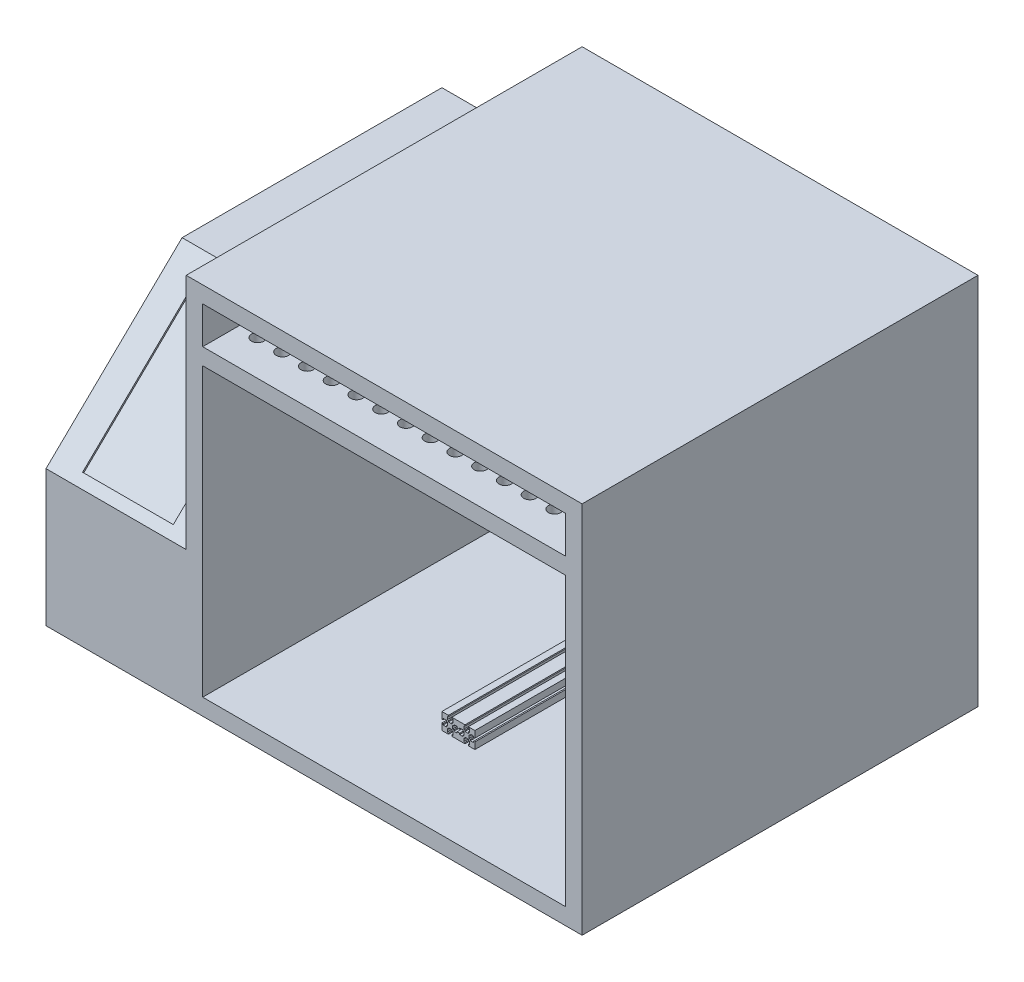
from build123d import *

# Parameters (mm, degrees)
SKETCH_1_W           = 150
SKETCH_1_H           = 285
SKETCH_1_W_2         = 440
SKETCH_1_H_2         = 348
SKETCH_1_H_3         = 45
EXTRUDE_1_DEPTH      = 480
EXTRUDE_2_DEPTH      = 20
SKETCH_3_R           = 7.5
CUT_EXTRUDE_7_DEPTH  = 20
SKETCH_3_8_R         = 7.5
CUT_EXTRUDE_8_DEPTH  = 20
SKETCH_3_9_R         = 7.5
CUT_EXTRUDE_9_DEPTH  = 20
SKETCH_3_10_R        = 7.5
CUT_EXTRUDE_10_DEPTH = 20
SKETCH_3_11_R        = 7.5
CUT_EXTRUDE_11_DEPTH = 20
SKETCH_10_W          = 40
SKETCH_10_H          = 350
EXTRUDE_4_DEPTH      = 20
SKETCH_11_W          = 40
SKETCH_11_H          = 20
EXTRUDE_6_DEPTH      = 348
CUT_EXTRUDE_12_DEPTH = 170
SKETCH_13_W          = 190
SKETCH_13_H          = 165
EXTRUDE_7_DEPTH      = 20
SKETCH_14_W          = 170
SKETCH_14_H          = 229.728125904
EXTRUDE_8_DEPTH      = 15
SKETCH_15_W          = 110
SKETCH_15_H          = 196.836898691
CUT_EXTRUDE_13_DEPTH = 2
EXTRUDE_12_DEPTH     = 20
SKETCH_17_W          = 43
SKETCH_17_H          = 43
EXTRUDE_13_DEPTH     = 20
SKETCH_18_W          = 40
SKETCH_18_H          = 41.625543016
EXTRUDE_14_DEPTH     = 40
SKETCH_19_W          = 40
SKETCH_19_H          = 40
EXTRUDE_15_DEPTH     = 40
EXTRUDE_16_DEPTH     = 2
SKETCH_22_R          = 4
EXTRUDE_17_DEPTH     = 308
SKETCH_23_R          = 12.5
EXTRUDE_18_DEPTH     = 18.496919089
CUT_EXTRUDE_14_DEPTH = 350
CUT_EXTRUDE_16_DEPTH = 395
EXTRUDE_19_DEPTH     = 10
SKETCH_28_R          = 2.5
CUT_EXTRUDE_17_DEPTH = 348


with BuildPart() as part:
    # 草图1 → 凸台-拉伸1 (new body)
    with BuildSketch(Plane.XY):
        Polygon((0, 325), (0, 0), (650, 0), (650, 453), (170, 453), (170, 325), align=None)
        with Locations((95, 162.5)):
            Rectangle(SKETCH_1_W, SKETCH_1_H, mode=Mode.SUBTRACT)
        with Locations((410, 194)):
            Rectangle(SKETCH_1_W_2, SKETCH_1_H_2, mode=Mode.SUBTRACT)
        with Locations((410, 410.5)):
            Rectangle(SKETCH_1_W_2, SKETCH_1_H_3, mode=Mode.SUBTRACT)
    extrude(amount=EXTRUDE_1_DEPTH)

    # 草图2 → 凸台-拉伸2 (add)
    with BuildSketch(Plane(origin=(0, 0, 0), x_dir=(-1, 0, 0), z_dir=(0, 0, -1))):
        Polygon((-650, 453), (-170, 453), (-170, 325), (0, 325), (0, 0), (-170, 0), (-650, 0), align=None)
    extrude(amount=-EXTRUDE_2_DEPTH)

    # 草图3 → 切除-拉伸7 (cut)
    with BuildSketch(Plane.XZ.offset(-368)):
        with Locations((213.812, 437.12)):
            Circle(SKETCH_3_R)
        with Locations((213.812, 407.12)):
            Circle(SKETCH_3_R)
        with Locations((213.812, 377.12)):
            Circle(SKETCH_3_R)
        with Locations((213.812, 347.12)):
            Circle(SKETCH_3_R)
        with Locations((213.812, 317.12)):
            Circle(SKETCH_3_R)
        with Locations((213.812, 287.12)):
            Circle(SKETCH_3_R)
        with Locations((213.812, 257.12)):
            Circle(SKETCH_3_R)
        with Locations((213.812, 227.12)):
            Circle(SKETCH_3_R)
        with Locations((213.812, 197.12)):
            Circle(SKETCH_3_R)
        with Locations((213.812, 167.12)):
            Circle(SKETCH_3_R)
        with Locations((213.812, 137.12)):
            Circle(SKETCH_3_R)
        with Locations((213.812, 107.12)):
            Circle(SKETCH_3_R)
        with Locations((213.812, 77.12)):
            Circle(SKETCH_3_R)
        with Locations((213.812, 47.12)):
            Circle(SKETCH_3_R)
        with Locations((243.812, 407.12)):
            Circle(SKETCH_3_R)
        with Locations((243.812, 377.12)):
            Circle(SKETCH_3_R)
        with Locations((243.812, 347.12)):
            Circle(SKETCH_3_R)
        with Locations((243.812, 317.12)):
            Circle(SKETCH_3_R)
        with Locations((243.812, 287.12)):
            Circle(SKETCH_3_R)
        with Locations((243.812, 257.12)):
            Circle(SKETCH_3_R)
        with Locations((243.812, 227.12)):
            Circle(SKETCH_3_R)
        with Locations((243.812, 197.12)):
            Circle(SKETCH_3_R)
        with Locations((243.812, 167.12)):
            Circle(SKETCH_3_R)
        with Locations((243.812, 137.12)):
            Circle(SKETCH_3_R)
        with Locations((243.812, 107.12)):
            Circle(SKETCH_3_R)
        with Locations((243.812, 77.12)):
            Circle(SKETCH_3_R)
        with Locations((243.812, 47.12)):
            Circle(SKETCH_3_R)
        with Locations((273.812, 407.12)):
            Circle(SKETCH_3_R)
        with Locations((273.812, 377.12)):
            Circle(SKETCH_3_R)
        with Locations((273.812, 347.12)):
            Circle(SKETCH_3_R)
        with Locations((273.812, 317.12)):
            Circle(SKETCH_3_R)
        with Locations((273.812, 287.12)):
            Circle(SKETCH_3_R)
        with Locations((273.812, 257.12)):
            Circle(SKETCH_3_R)
        with Locations((273.812, 227.12)):
            Circle(SKETCH_3_R)
        with Locations((273.812, 197.12)):
            Circle(SKETCH_3_R)
        with Locations((273.812, 167.12)):
            Circle(SKETCH_3_R)
        with Locations((273.812, 137.12)):
            Circle(SKETCH_3_R)
        with Locations((273.812, 107.12)):
            Circle(SKETCH_3_R)
        with Locations((273.812, 77.12)):
            Circle(SKETCH_3_R)
        with Locations((273.812, 47.12)):
            Circle(SKETCH_3_R)
        with Locations((303.812, 407.12)):
            Circle(SKETCH_3_R)
        with Locations((303.812, 377.12)):
            Circle(SKETCH_3_R)
        with Locations((303.812, 347.12)):
            Circle(SKETCH_3_R)
        with Locations((303.812, 317.12)):
            Circle(SKETCH_3_R)
        with Locations((303.812, 287.12)):
            Circle(SKETCH_3_R)
        with Locations((303.812, 257.12)):
            Circle(SKETCH_3_R)
        with Locations((303.812, 227.12)):
            Circle(SKETCH_3_R)
        with Locations((303.812, 197.12)):
            Circle(SKETCH_3_R)
        with Locations((303.812, 167.12)):
            Circle(SKETCH_3_R)
        with Locations((303.812, 137.12)):
            Circle(SKETCH_3_R)
        with Locations((303.812, 107.12)):
            Circle(SKETCH_3_R)
        with Locations((303.812, 77.12)):
            Circle(SKETCH_3_R)
        with Locations((303.812, 47.12)):
            Circle(SKETCH_3_R)
        with Locations((333.812, 407.12)):
            Circle(SKETCH_3_R)
        with Locations((333.812, 377.12)):
            Circle(SKETCH_3_R)
        with Locations((333.812, 347.12)):
            Circle(SKETCH_3_R)
        with Locations((333.812, 317.12)):
            Circle(SKETCH_3_R)
        with Locations((333.812, 287.12)):
            Circle(SKETCH_3_R)
        with Locations((333.812, 257.12)):
            Circle(SKETCH_3_R)
        with Locations((333.812, 227.12)):
            Circle(SKETCH_3_R)
        with Locations((333.812, 197.12)):
            Circle(SKETCH_3_R)
        with Locations((333.812, 167.12)):
            Circle(SKETCH_3_R)
        with Locations((333.812, 137.12)):
            Circle(SKETCH_3_R)
        with Locations((333.812, 107.12)):
            Circle(SKETCH_3_R)
        with Locations((333.812, 77.12)):
            Circle(SKETCH_3_R)
        with Locations((333.812, 47.12)):
            Circle(SKETCH_3_R)
        with Locations((363.812, 407.12)):
            Circle(SKETCH_3_R)
        with Locations((363.812, 377.12)):
            Circle(SKETCH_3_R)
        with Locations((363.812, 347.12)):
            Circle(SKETCH_3_R)
        with Locations((363.812, 317.12)):
            Circle(SKETCH_3_R)
        with Locations((363.812, 287.12)):
            Circle(SKETCH_3_R)
        with Locations((363.812, 257.12)):
            Circle(SKETCH_3_R)
        with Locations((363.812, 227.12)):
            Circle(SKETCH_3_R)
        with Locations((363.812, 197.12)):
            Circle(SKETCH_3_R)
        with Locations((363.812, 167.12)):
            Circle(SKETCH_3_R)
        with Locations((363.812, 137.12)):
            Circle(SKETCH_3_R)
        with Locations((363.812, 107.12)):
            Circle(SKETCH_3_R)
        with Locations((363.812, 77.12)):
            Circle(SKETCH_3_R)
        with Locations((363.812, 47.12)):
            Circle(SKETCH_3_R)
        with Locations((243.812, 437.12)):
            Circle(SKETCH_3_R)
        with Locations((273.812, 437.12)):
            Circle(SKETCH_3_R)
        with Locations((303.812, 437.12)):
            Circle(SKETCH_3_R)
        with Locations((333.812, 437.12)):
            Circle(SKETCH_3_R)
        with Locations((363.812, 437.12)):
            Circle(SKETCH_3_R)
    extrude(amount=-CUT_EXTRUDE_7_DEPTH, mode=Mode.SUBTRACT)

    # 草图3<8> → 切除-拉伸8 (cut)
    with BuildSketch(Plane.XZ.offset(-368)):
        with Locations((393.812, 407.12)):
            Circle(SKETCH_3_8_R)
        with Locations((393.812, 377.12)):
            Circle(SKETCH_3_8_R)
        with Locations((393.812, 347.12)):
            Circle(SKETCH_3_8_R)
        with Locations((393.812, 317.12)):
            Circle(SKETCH_3_8_R)
        with Locations((393.812, 287.12)):
            Circle(SKETCH_3_8_R)
        with Locations((393.812, 257.12)):
            Circle(SKETCH_3_8_R)
        with Locations((393.812, 227.12)):
            Circle(SKETCH_3_8_R)
        with Locations((393.812, 197.12)):
            Circle(SKETCH_3_8_R)
        with Locations((393.812, 167.12)):
            Circle(SKETCH_3_8_R)
        with Locations((393.812, 137.12)):
            Circle(SKETCH_3_8_R)
        with Locations((393.812, 107.12)):
            Circle(SKETCH_3_8_R)
        with Locations((393.812, 77.12)):
            Circle(SKETCH_3_8_R)
        with Locations((393.812, 47.12)):
            Circle(SKETCH_3_8_R)
        with Locations((423.812, 407.12)):
            Circle(SKETCH_3_8_R)
        with Locations((423.812, 377.12)):
            Circle(SKETCH_3_8_R)
        with Locations((423.812, 347.12)):
            Circle(SKETCH_3_8_R)
        with Locations((423.812, 317.12)):
            Circle(SKETCH_3_8_R)
        with Locations((423.812, 287.12)):
            Circle(SKETCH_3_8_R)
        with Locations((423.812, 257.12)):
            Circle(SKETCH_3_8_R)
        with Locations((423.812, 227.12)):
            Circle(SKETCH_3_8_R)
        with Locations((423.812, 197.12)):
            Circle(SKETCH_3_8_R)
        with Locations((423.812, 167.12)):
            Circle(SKETCH_3_8_R)
        with Locations((423.812, 137.12)):
            Circle(SKETCH_3_8_R)
        with Locations((423.812, 107.12)):
            Circle(SKETCH_3_8_R)
        with Locations((423.812, 77.12)):
            Circle(SKETCH_3_8_R)
        with Locations((423.812, 47.12)):
            Circle(SKETCH_3_8_R)
        with Locations((453.812, 407.12)):
            Circle(SKETCH_3_8_R)
        with Locations((453.812, 377.12)):
            Circle(SKETCH_3_8_R)
        with Locations((453.812, 347.12)):
            Circle(SKETCH_3_8_R)
        with Locations((453.812, 317.12)):
            Circle(SKETCH_3_8_R)
        with Locations((453.812, 287.12)):
            Circle(SKETCH_3_8_R)
        with Locations((453.812, 257.12)):
            Circle(SKETCH_3_8_R)
        with Locations((453.812, 227.12)):
            Circle(SKETCH_3_8_R)
        with Locations((453.812, 197.12)):
            Circle(SKETCH_3_8_R)
        with Locations((453.812, 167.12)):
            Circle(SKETCH_3_8_R)
        with Locations((453.812, 137.12)):
            Circle(SKETCH_3_8_R)
        with Locations((453.812, 107.12)):
            Circle(SKETCH_3_8_R)
        with Locations((453.812, 77.12)):
            Circle(SKETCH_3_8_R)
        with Locations((453.812, 47.12)):
            Circle(SKETCH_3_8_R)
        with Locations((393.812, 437.12)):
            Circle(SKETCH_3_8_R)
        with Locations((423.812, 437.12)):
            Circle(SKETCH_3_8_R)
        with Locations((453.812, 437.12)):
            Circle(SKETCH_3_8_R)
    extrude(amount=-CUT_EXTRUDE_8_DEPTH, mode=Mode.SUBTRACT)

    # 草图3<9> → 切除-拉伸9 (cut)
    with BuildSketch(Plane.XZ.offset(-368)):
        with Locations((483.812, 407.12)):
            Circle(SKETCH_3_9_R)
        with Locations((483.812, 377.12)):
            Circle(SKETCH_3_9_R)
        with Locations((483.812, 347.12)):
            Circle(SKETCH_3_9_R)
        with Locations((483.812, 317.12)):
            Circle(SKETCH_3_9_R)
        with Locations((483.812, 287.12)):
            Circle(SKETCH_3_9_R)
        with Locations((483.812, 257.12)):
            Circle(SKETCH_3_9_R)
        with Locations((483.812, 227.12)):
            Circle(SKETCH_3_9_R)
        with Locations((483.812, 197.12)):
            Circle(SKETCH_3_9_R)
        with Locations((483.812, 167.12)):
            Circle(SKETCH_3_9_R)
        with Locations((483.812, 137.12)):
            Circle(SKETCH_3_9_R)
        with Locations((483.812, 107.12)):
            Circle(SKETCH_3_9_R)
        with Locations((483.812, 77.12)):
            Circle(SKETCH_3_9_R)
        with Locations((483.812, 47.12)):
            Circle(SKETCH_3_9_R)
        with Locations((483.812, 437.12)):
            Circle(SKETCH_3_9_R)
    extrude(amount=-CUT_EXTRUDE_9_DEPTH, mode=Mode.SUBTRACT)

    # 草图3<10> → 切除-拉伸10 (cut)
    with BuildSketch(Plane.XZ.offset(-368)):
        with Locations((513.812, 407.12)):
            Circle(SKETCH_3_10_R)
        with Locations((513.812, 377.12)):
            Circle(SKETCH_3_10_R)
        with Locations((513.812, 347.12)):
            Circle(SKETCH_3_10_R)
        with Locations((513.812, 317.12)):
            Circle(SKETCH_3_10_R)
        with Locations((513.812, 287.12)):
            Circle(SKETCH_3_10_R)
        with Locations((513.812, 257.12)):
            Circle(SKETCH_3_10_R)
        with Locations((513.812, 227.12)):
            Circle(SKETCH_3_10_R)
        with Locations((513.812, 197.12)):
            Circle(SKETCH_3_10_R)
        with Locations((513.812, 167.12)):
            Circle(SKETCH_3_10_R)
        with Locations((513.812, 137.12)):
            Circle(SKETCH_3_10_R)
        with Locations((513.812, 107.12)):
            Circle(SKETCH_3_10_R)
        with Locations((513.812, 77.12)):
            Circle(SKETCH_3_10_R)
        with Locations((513.812, 47.12)):
            Circle(SKETCH_3_10_R)
        with Locations((543.812, 407.12)):
            Circle(SKETCH_3_10_R)
        with Locations((543.812, 377.12)):
            Circle(SKETCH_3_10_R)
        with Locations((543.812, 347.12)):
            Circle(SKETCH_3_10_R)
        with Locations((543.812, 317.12)):
            Circle(SKETCH_3_10_R)
        with Locations((543.812, 287.12)):
            Circle(SKETCH_3_10_R)
        with Locations((543.812, 257.12)):
            Circle(SKETCH_3_10_R)
        with Locations((543.812, 227.12)):
            Circle(SKETCH_3_10_R)
        with Locations((543.812, 197.12)):
            Circle(SKETCH_3_10_R)
        with Locations((543.812, 167.12)):
            Circle(SKETCH_3_10_R)
        with Locations((543.812, 137.12)):
            Circle(SKETCH_3_10_R)
        with Locations((543.812, 107.12)):
            Circle(SKETCH_3_10_R)
        with Locations((543.812, 77.12)):
            Circle(SKETCH_3_10_R)
        with Locations((543.812, 47.12)):
            Circle(SKETCH_3_10_R)
        with Locations((573.812, 407.12)):
            Circle(SKETCH_3_10_R)
        with Locations((573.812, 377.12)):
            Circle(SKETCH_3_10_R)
        with Locations((573.812, 347.12)):
            Circle(SKETCH_3_10_R)
        with Locations((573.812, 317.12)):
            Circle(SKETCH_3_10_R)
        with Locations((603.812, 407.12)):
            Circle(SKETCH_3_10_R)
        with Locations((603.812, 377.12)):
            Circle(SKETCH_3_10_R)
        with Locations((603.812, 347.12)):
            Circle(SKETCH_3_10_R)
        with Locations((603.812, 317.12)):
            Circle(SKETCH_3_10_R)
        with Locations((513.812, 437.12)):
            Circle(SKETCH_3_10_R)
        with Locations((543.812, 437.12)):
            Circle(SKETCH_3_10_R)
        with Locations((573.812, 437.12)):
            Circle(SKETCH_3_10_R)
        with Locations((603.812, 437.12)):
            Circle(SKETCH_3_10_R)
    extrude(amount=-CUT_EXTRUDE_10_DEPTH, mode=Mode.SUBTRACT)

    # 草图3<11> → 切除-拉伸11 (cut)
    with BuildSketch(Plane.XZ.offset(-368)):
        with Locations((573.812, 287.12)):
            Circle(SKETCH_3_11_R)
        with Locations((573.812, 257.12)):
            Circle(SKETCH_3_11_R)
        with Locations((573.812, 227.12)):
            Circle(SKETCH_3_11_R)
        with Locations((573.812, 197.12)):
            Circle(SKETCH_3_11_R)
        with Locations((573.812, 167.12)):
            Circle(SKETCH_3_11_R)
        with Locations((573.812, 137.12)):
            Circle(SKETCH_3_11_R)
        with Locations((573.812, 107.12)):
            Circle(SKETCH_3_11_R)
        with Locations((573.812, 77.12)):
            Circle(SKETCH_3_11_R)
        with Locations((573.812, 47.12)):
            Circle(SKETCH_3_11_R)
        with Locations((603.812, 287.12)):
            Circle(SKETCH_3_11_R)
        with Locations((603.812, 257.12)):
            Circle(SKETCH_3_11_R)
        with Locations((603.812, 227.12)):
            Circle(SKETCH_3_11_R)
        with Locations((603.812, 197.12)):
            Circle(SKETCH_3_11_R)
        with Locations((603.812, 167.12)):
            Circle(SKETCH_3_11_R)
        with Locations((603.812, 137.12)):
            Circle(SKETCH_3_11_R)
        with Locations((603.812, 107.12)):
            Circle(SKETCH_3_11_R)
        with Locations((603.812, 77.12)):
            Circle(SKETCH_3_11_R)
        with Locations((603.812, 47.12)):
            Circle(SKETCH_3_11_R)
    extrude(amount=-CUT_EXTRUDE_11_DEPTH, mode=Mode.SUBTRACT)

    # 草图10 → 凸台-拉伸4 (add)
    with BuildSketch(Plane(origin=(0, 20, 0), x_dir=(1, 0, 0), z_dir=(0, 1, 0))):
        with Locations((390, -195)):
            Rectangle(SKETCH_10_W, SKETCH_10_H)
    extrude(amount=EXTRUDE_4_DEPTH)

    # 草图11 → 凸台-拉伸6 (add)
    with BuildSketch(Plane(origin=(0, 20, 0), x_dir=(1, 0, 0), z_dir=(0, 1, 0))):
        with Locations((260, -120)):
            Rectangle(SKETCH_11_W, SKETCH_11_H)
    extrude(amount=EXTRUDE_6_DEPTH)

    # 草图12 → 切除-拉伸12 (cut)
    with BuildSketch(Plane.ZY):
        Polygon((315, 325), (480, 165), (480, 325), align=None)
    extrude(amount=-CUT_EXTRUDE_12_DEPTH, mode=Mode.SUBTRACT)

    # 草图13 → 凸台-拉伸7 (add)
    with BuildSketch(Plane.XY.offset(480)):
        with Locations((95, 82.5)):
            Rectangle(SKETCH_13_W, SKETCH_13_H)
    extrude(amount=-EXTRUDE_7_DEPTH)

    # 草图14 → 凸台-拉伸8 (add)
    with BuildSketch(Plane(origin=(0, 324.924278277, 315.078088027), x_dir=(1, 0, 0), z_dir=(0, 0.7179003934510547, 0.6961458360737504))):
        with Locations((85, -114.864062952)):
            Rectangle(SKETCH_14_W, SKETCH_14_H)
    extrude(amount=-EXTRUDE_8_DEPTH)

    # 草图15 → 切除-拉伸13 (cut)
    with BuildSketch(Plane(origin=(0, 324.924278277, 315.078088027), x_dir=(1, 0, 0), z_dir=(0, 0.7179003934510547, 0.6961458360737504))):
        with Locations((90, -118.309676559)):
            Rectangle(SKETCH_15_W, SKETCH_15_H)
    extrude(amount=-CUT_EXTRUDE_13_DEPTH, mode=Mode.SUBTRACT)

    # 草图16 → 凸台-拉伸12 (add)
    with BuildSketch(Plane.XY.offset(130)):
        Polygon((190, 322.508526994), (190, 279.508526994), (233, 279.508526994), (233, 290.431026769), (630, 290.431026769), (630, 310.431026769), (233, 310.431026769), (233, 322.508526994), align=None)
    extrude(amount=EXTRUDE_12_DEPTH)

    # 草图17 → 凸台-拉伸13 (add)
    with BuildSketch(Plane.XY.offset(150)):
        with Locations((211.5, 301.008526994)):
            Rectangle(SKETCH_17_W, SKETCH_17_H)
    extrude(amount=EXTRUDE_13_DEPTH)

    # 草图18 → 凸台-拉伸14 (add)
    with BuildSketch(Plane(origin=(0, 20, 0), x_dir=(1, 0, 0), z_dir=(0, 1, 0))):
        with Locations((350, -40.812771508)):
            Rectangle(SKETCH_18_W, SKETCH_18_H)
    extrude(amount=EXTRUDE_14_DEPTH)

    # 草图19 → 凸台-拉伸15 (add)
    with BuildSketch(Plane(origin=(0, 20, 0), x_dir=(1, 0, 0), z_dir=(0, 1, 0))):
        with Locations((260.140440474, -89.968153506)):
            Rectangle(SKETCH_19_W, SKETCH_19_H)
    extrude(amount=EXTRUDE_15_DEPTH)

    # 草图20 → 凸台-拉伸16 (add)
    with BuildSketch(Plane.XY.offset(150)):
        Polygon((400.642585032, 290.431026769), (416.443158579, 260.244746017), (446.443158579, 260.244746017), (460.642585032, 290.431026769), (460.642585032, 325.244746017), (400.642585032, 325.244746017), align=None)
    extrude(amount=EXTRUDE_16_DEPTH)

    # 草图22 → 凸台-拉伸17 (add)
    with BuildSketch(Plane(origin=(0, 60, 0), x_dir=(1, 0, 0), z_dir=(0, 1, 0))):
        with Locations((259.322306409, -90.300153573)):
            Circle(SKETCH_22_R)
    extrude(amount=EXTRUDE_17_DEPTH)

    # 草图23 → 凸台-拉伸18 (add)
    with BuildSketch(Plane(origin=(0, 60, 0), x_dir=(1, 0, 0), z_dir=(0, 1, 0))):
        with Locations((259.332093029, -90.408088983)):
            Circle(SKETCH_23_R)
    extrude(amount=EXTRUDE_18_DEPTH)

    # 草图24 → 切除-拉伸14 (cut)
    with BuildSketch(Plane.XY.offset(370)):
        Polygon((391.5, 32), (388.5, 32), (388.5, 33.5), (384.5, 33.5), (384.5, 32), (383, 32), (383, 28), (384.5, 28), (384.5, 26.5), (388.5, 26.5), (388.5, 28), (391.5, 28), (391.5, 26.5), (395.5, 26.5), (395.5, 28), (397, 28), (397, 32), (395.5, 32), (395.5, 33.5), (391.5, 33.5), align=None)
        Polygon((402, 40), (398, 40), (398, 38.5), (396.5, 38.5), (396.5, 34.5), (398, 34.5), (398, 33), (402, 33), (402, 34.5), (403.5, 34.5), (403.5, 38.5), (402, 38.5), align=None)
        Polygon((382, 38.5), (382, 40), (378, 40), (378, 38.5), (376.5, 38.5), (376.5, 34.5), (378, 34.5), (378, 33), (382, 33), (382, 34.5), (383.5, 34.5), (383.5, 38.5), align=None)
        Polygon((398, 20), (402, 20), (402, 21.5), (403.5, 21.5), (403.5, 25.5), (402, 25.5), (402, 27), (398, 27), (398, 25.5), (396.5, 25.5), (396.5, 21.5), (398, 21.5), align=None)
        Polygon((408.5, 28), (410, 28), (410, 32), (408.5, 32), (408.5, 33.5), (404.5, 33.5), (404.5, 32), (403, 32), (403, 28), (404.5, 28), (404.5, 26.5), (408.5, 26.5), align=None)
        Polygon((378, 20), (382, 20), (382, 21.5), (383.5, 21.5), (383.5, 25.5), (382, 25.5), (382, 27), (378, 27), (378, 25.5), (376.5, 25.5), (376.5, 21.5), (378, 21.5), align=None)
        Polygon((371.5, 32), (370, 32), (370, 28), (371.5, 28), (371.5, 26.5), (375.5, 26.5), (375.5, 28), (377, 28), (377, 32), (375.5, 32), (375.5, 33.5), (371.5, 33.5), align=None)
    extrude(amount=-CUT_EXTRUDE_14_DEPTH, mode=Mode.SUBTRACT)

    # 草图26 → 切除-拉伸16 (cut)
    with BuildSketch(Plane.ZY.offset(-630)):
        Polygon((144.216118477, 310.431008784), (144.216118477, 308.931008784), (145.716118477, 308.931008784), (145.716118477, 304.931008784), (144.216118477, 304.931008784), (144.216118477, 303.431008784), (140.216118477, 303.431008784), (140.216118477, 304.931008784), (138.716118477, 304.931008784), (138.716118477, 308.931008784), (140.216118477, 308.931008784), (140.216118477, 310.431008784), align=None)
        Polygon((144.216118477, 290.431008784), (140.216118477, 290.431008784), (140.216118477, 291.931008784), (138.716118477, 291.931008784), (138.716118477, 295.931008784), (140.216118477, 295.931008784), (140.216118477, 297.431008784), (144.216118477, 297.431008784), (144.216118477, 295.931008784), (145.716118477, 295.931008784), (145.716118477, 291.931008784), (144.216118477, 291.931008784), align=None)
        Polygon((152.216118477, 298.431008784), (152.216118477, 302.431008784), (150.716118477, 302.431008784), (150.716118477, 303.931008784), (146.716118477, 303.931008784), (146.716118477, 302.431008784), (145.216118477, 302.431008784), (145.216118477, 298.431008784), (146.716118477, 298.431008784), (146.716118477, 296.931008784), (150.716118477, 296.931008784), (150.716118477, 298.431008784), align=None)
        Polygon((132.216118477, 298.431008784), (132.216118477, 302.431008784), (133.716118477, 302.431008784), (133.716118477, 303.931008784), (137.716118477, 303.931008784), (137.716118477, 302.431008784), (139.216118477, 302.431008784), (139.216118477, 298.431008784), (137.716118477, 298.431008784), (137.716118477, 296.931008784), (133.716118477, 296.931008784), (133.716118477, 298.431008784), align=None)
    extrude(amount=CUT_EXTRUDE_16_DEPTH, mode=Mode.SUBTRACT)

    # 草图27 → 凸台-拉伸19 (add)
    with BuildSketch(Plane.XY.offset(152)):
        Polygon((426.238202642, 253.518288114), (430.982092395, 249.863736008), (435.725982148, 253.518288114), (435.725982148, 269.963772592), (426.238202642, 269.963772592), align=None)
    extrude(amount=EXTRUDE_19_DEPTH)

    # 扫描1: sweep along a path in 草图29
    with BuildLine(Plane(origin=(650, 0, 0), x_dir=(0, 0, -1), z_dir=(1, 0, 0))) as sweep_1_path:
        Line((-156.971491392, 269.963772592), (-156.971491392, 391.042544271))
        ThreePointArc((-156.971491392, 391.042544271), (-152.57809311, 401.649145988), (-141.971491392, 406.042544271))
        Line((-141.971491392, 406.042544271), (0, 406.042544271))
    # 草图28 → 扫描1 (sweep)
    with BuildSketch(Plane(origin=(0, 269.963772592, 0), x_dir=(1, 0, 0), z_dir=(0, 1, 0))):
        with Locations((431.008712111, -156.971491392)):
            Circle(SKETCH_28_R)
    sweep(path=sweep_1_path.line)

    # 草图32 → 切除-拉伸17 (cut)
    with BuildSketch(Plane(origin=(0, 20, 0), x_dir=(1, 0, 0), z_dir=(0, 1, 0))):
        Polygon((248.017713059, -128.461992258), (248.017713059, -129.961992258), (252.017713059, -129.961992258), (252.017713059, -128.461992258), (253.517713059, -128.461992258), (253.517713059, -124.461992258), (252.017713059, -124.461992258), (252.017713059, -122.961992258), (248.017713059, -122.961992258), (248.017713059, -124.461992258), (246.517713059, -124.461992258), (246.517713059, -128.461992258), align=None)
        Polygon((240.017713059, -117.961992258), (240.017713059, -121.961992258), (241.517713059, -121.961992258), (241.517713059, -123.461992258), (245.517713059, -123.461992258), (245.517713059, -121.961992258), (247.017713059, -121.961992258), (247.017713059, -117.961992258), (245.517713059, -117.961992258), (245.517713059, -116.461992258), (241.517713059, -116.461992258), (241.517713059, -117.961992258), align=None)
        Polygon((280, -121.961992258), (280, -117.961992258), (278.517713059, -117.961992258), (278.517713059, -116.461992258), (274.517713059, -116.461992258), (274.517713059, -117.961992258), (273.017713059, -117.961992258), (273.017713059, -121.961992258), (274.517713059, -121.961992258), (274.517713059, -123.461992258), (278.517713059, -123.461992258), (278.517713059, -121.961992258), align=None)
        Polygon((272.017713059, -110), (268.017713059, -110), (268.017713059, -111.461992258), (266.517713059, -111.461992258), (266.517713059, -115.461992258), (268.017713059, -115.461992258), (268.017713059, -116.961992258), (272.017713059, -116.961992258), (272.017713059, -115.461992258), (273.517713059, -115.461992258), (273.517713059, -111.461992258), (272.017713059, -111.461992258), align=None)
        Polygon((252.017713059, -110), (248.017713059, -110), (248.017713059, -111.461992258), (246.517713059, -111.461992258), (246.517713059, -115.461992258), (248.017713059, -115.461992258), (248.017713059, -116.961992258), (252.017713059, -116.961992258), (252.017713059, -115.461992258), (253.517713059, -115.461992258), (253.517713059, -111.461992258), (252.017713059, -111.461992258), align=None)
        Polygon((268.017713059, -129.961992258), (272.017713059, -129.961992258), (272.017713059, -128.461992258), (273.517713059, -128.461992258), (273.517713059, -124.461992258), (272.017713059, -124.461992258), (272.017713059, -122.961992258), (268.017713059, -122.961992258), (268.017713059, -124.461992258), (266.517713059, -124.461992258), (266.517713059, -128.461992258), (268.017713059, -128.461992258), align=None)
        Polygon((258.517713059, -121.961992258), (261.517713059, -121.961992258), (261.517713059, -123.461992258), (265.517713059, -123.461992258), (265.517713059, -121.961992258), (267.017713059, -121.961992258), (267.017713059, -117.961992258), (265.517713059, -117.961992258), (265.517713059, -116.461992258), (261.517713059, -116.461992258), (261.517713059, -117.961992258), (258.517713059, -117.961992258), (258.517713059, -116.461992258), (254.517713059, -116.461992258), (254.517713059, -117.961992258), (253.017713059, -117.961992258), (253.017713059, -121.961992258), (254.517713059, -121.961992258), (254.517713059, -123.461992258), (258.517713059, -123.461992258), align=None)
    extrude(amount=CUT_EXTRUDE_17_DEPTH, mode=Mode.SUBTRACT)


solid = part.part
